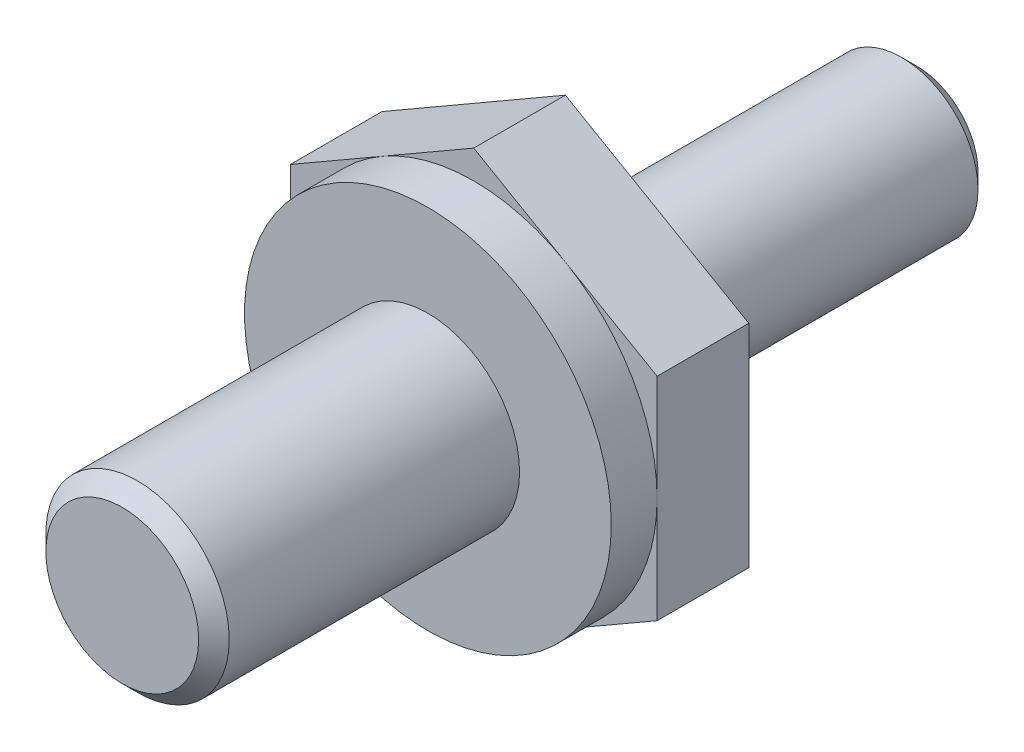
from build123d import *
from build123d.topology import SkipClean

# Parameters (mm, degrees)
SKETCH_1_R          = 2.5
EXTRUDE_228_DEPTH   = 10
EXTRUDE_1_DEPTH     = 1.5
EXTRUDE_2_DEPTH     = 3
SKETCH_4_R          = 6
EXTRUDE_3_DEPTH     = 1.5
SKETCH_5_R          = 3
EXTRUDE_4_DEPTH     = 10
CHAMFER_1_SIZE      = 0.5
SKETCH_6_R          = 2.5
CUT_EXTRUDE_2_DEPTH = 1.5


with BuildPart() as part:
    # Эскиз1 → Extrude 228 (new body)
    with BuildSketch(Plane.XY):
        Circle(SKETCH_1_R)
    extrude(amount=EXTRUDE_228_DEPTH)

    # Эскиз2 → Бобышка-Вытянуть1 (add)
    with BuildSketch(Plane.XY.offset(10)):
        with BuildLine():
            Line((-3, 2.645751311), (-3, -2.645751311))
            ThreePointArc((-3, -2.645751311), (0, -4), (3, -2.645751311))
            Line((3, -2.645751311), (3, 2.645751311))
            ThreePointArc((3, 2.645751311), (0, 4), (-3, 2.645751311))
        make_face()
    extrude(amount=EXTRUDE_1_DEPTH)

    # Эскиз3 → Бобышка-Вытянуть2 (add)
    with BuildSketch(Plane.XY.offset(11.5)):
        Polygon((0, -6.92820323), (6, -3.464101615), (6, 3.464101615), (0, 6.92820323), (-6, 3.464101615), (-6, -3.464101615), align=None)
    extrude(amount=EXTRUDE_2_DEPTH)

    # Эскиз4 → Бобышка-Вытянуть3 (add)
    with BuildSketch(Plane.XY.offset(14.5)):
        Circle(SKETCH_4_R)
    extrude(amount=EXTRUDE_3_DEPTH)

    # Эскиз5 → Бобышка-Вытянуть4 (add)
    with BuildSketch(Plane.XY.offset(16)):
        Circle(SKETCH_5_R)
    extrude(amount=EXTRUDE_4_DEPTH)

    # Фаска1
    chamfer_1_edges = [part.edges().sort_by_distance(p)[0] for p in [
        (-2.5, 0, 0),
        (-3, 0, 26),
    ]]
    chamfer(chamfer_1_edges, length=CHAMFER_1_SIZE)

    # Эскиз6 → Вырез-Вытянуть2 (cut)
    with SkipClean():  # the faces are left unmerged after this step: merging them gives an invalid solid
        with BuildSketch(Plane(origin=(0, 0, 10), x_dir=(-1, 0, 0), z_dir=(0, 0, -1))):
            with BuildLine():
                Line((-3, 2.645751311), (-3, -2.645751311))
                ThreePointArc((-3, -2.645751311), (0, -4), (3, -2.645751311))
                Line((3, -2.645751311), (3, 2.645751311))
                ThreePointArc((3, 2.645751311), (0, 4), (-3, 2.645751311))
            make_face()
            Circle(SKETCH_6_R, mode=Mode.SUBTRACT)
        extrude(amount=-CUT_EXTRUDE_2_DEPTH, mode=Mode.SUBTRACT)


solid = part.part
